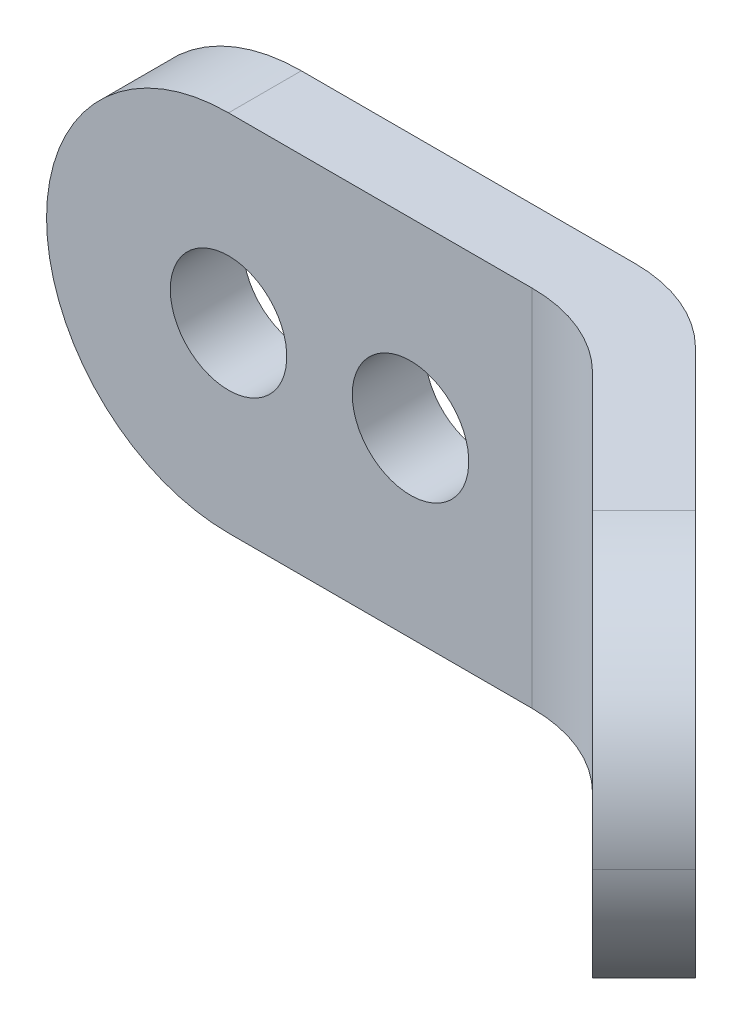
from build123d import *

# Parameters (mm, degrees)
SKETCH_1_W          = 25
SKETCH_1_H          = 10
SKETCH_1_R          = 1.6
EXTRUDE_1_DEPTH     = 10
CUT_EXTRUDE_1_REACH = 20.875
CUT_EXTRUDE_2_REACH = 20.875
SKETCH_4_R          = 2
CUT_EXTRUDE_3_DEPTH = 20.017855396
FILLET_1_R          = 4
FILLET_2_R          = 5


with BuildPart() as part:
    # ｽｹｯﾁ1 → ﾎﾞｽ - 押し出し1 (new body)
    with BuildSketch(Plane.XY):
        Rectangle(SKETCH_1_W, SKETCH_1_H)
        with Locations((-7.5, 0)):
            Circle(SKETCH_1_R, mode=Mode.SUBTRACT)
        with Locations((-2.5, 0)):
            Circle(SKETCH_1_R, mode=Mode.SUBTRACT)
    extrude(amount=EXTRUDE_1_DEPTH)

    # ｽｹｯﾁ2 → ｶｯﾄ - 押し出し1 (cut, up to next)
    with BuildSketch(Plane.XZ.offset(5), mode=Mode.PRIVATE) as cut_extrude_1_sk1:
        Polygon((2.5, 10), (10.5, 10), (2.5, 2), (-12.5, 2), (-12.5, 10), align=None)
    cut_extrude_1_tool1 = extrude(cut_extrude_1_sk1.sketch, amount=-CUT_EXTRUDE_1_REACH, mode=Mode.PRIVATE) & part.part
    # ｽｹｯﾁ2 → ｶｯﾄ - 押し出し1 (cut, up to next)
    with BuildSketch(Plane.XZ.offset(5), mode=Mode.PRIVATE) as cut_extrude_1_sk2:
        Polygon((3.328427125, 0), (12.5, 9.171572875), (12.5, 0), align=None)
    cut_extrude_1_tool2 = extrude(cut_extrude_1_sk2.sketch, amount=-CUT_EXTRUDE_1_REACH, mode=Mode.PRIVATE) & part.part
    add(cut_extrude_1_tool1.solids().sort_by_distance((-2.859649, -5, 6.280702))[0], mode=Mode.SUBTRACT)
    add(cut_extrude_1_tool2.solids().sort_by_distance((9.442809, -5, 3.057191))[0], mode=Mode.SUBTRACT)

    # ｽｹｯﾁ3 → ｶｯﾄ - 押し出し2 (cut, up to next)
    with BuildSketch(Plane.XZ.offset(5), mode=Mode.PRIVATE) as cut_extrude_2_sk1:
        Polygon((10.5, 10), (11.914213562, 8.585786438), (12.5, 9.171572875), (12.5, 10), align=None)
    cut_extrude_2_tool1 = extrude(cut_extrude_2_sk1.sketch, amount=-CUT_EXTRUDE_2_REACH, mode=Mode.PRIVATE) & part.part
    add(cut_extrude_2_tool1.solids().sort_by_distance((11.735702, -5, 9.488155))[0], mode=Mode.SUBTRACT)

    # ｽｹｯﾁ4 → ｶｯﾄ - 押し出し3 (cut, through all)
    with BuildSketch(Plane(origin=(1.664213562, 0, -1.664213562), x_dir=(-0.7071067811865509, 0, -0.7071067811865441), z_dir=(0.7071067811865441, 0, -0.7071067811865509))):
        with Locations((-11.203553391, 0)):
            Circle(SKETCH_4_R)
    extrude(amount=-CUT_EXTRUDE_3_DEPTH, mode=Mode.SUBTRACT)

    # ﾌｨﾚｯﾄ1
    fillet_1_edges = [part.edges().sort_by_distance(p)[0] for p in [
        (3.328427125, 0, 0),
        (2.5, 0, 2),
    ]]
    fillet(fillet_1_edges, radius=FILLET_1_R)

    # ﾌｨﾚｯﾄ2
    fillet_2_edges = [part.edges().sort_by_distance(p)[0] for p in [
        (11.207106781, 5, 9.292893219),
        (11.207106781, -5, 9.292893219),
        (-12.5, -5, 1),
        (-12.5, 5, 1),
    ]]
    fillet(fillet_2_edges, radius=FILLET_2_R - 0.0001)  # a hair under: the kernel refuses the full size


solid = part.part
